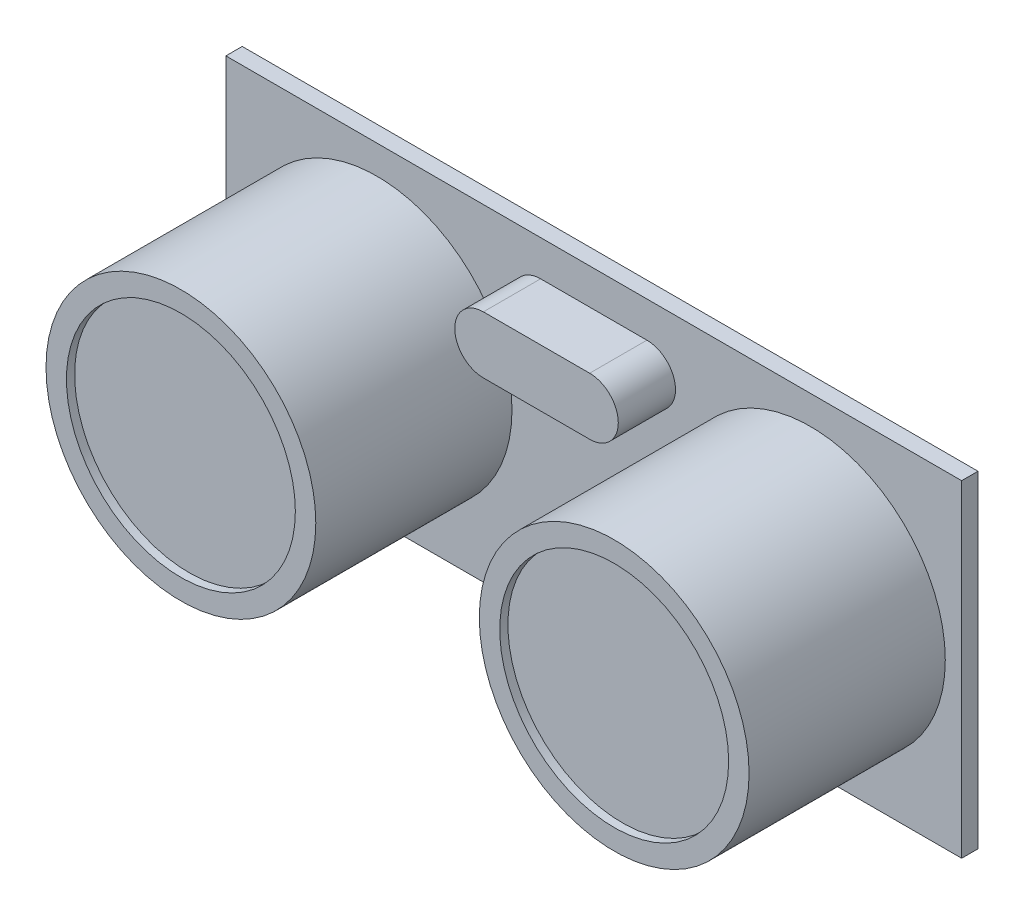
from build123d import *

# Parameters (mm, degrees)
ESBO_O1_W                = 45
ESBO_O1_H                = 20
RESSALTO_EXTRUS_O1_DEPTH = 1
ESBO_O2_R                = 8.25
RESSALTO_EXTRUS_O2_DEPTH = 12
ESBO_O3_R                = 7
CORTE_EXTRUS_O1_DEPTH    = 0.5
RESSALTO_EXTRUS_O5_DEPTH = 3.5
ESBO_O7_W                = 1.9
ESBO_O7_H                = 2
ESBO_O7_W_2              = 1.8
RESSALTO_EXTRUS_O6_DEPTH = 2
ESBO_O9_W                = 10
ESBO_O9_H                = 0.1
CORTE_EXTRUS_O2_DEPTH    = 2
ESBO_O10_W               = 1
ESBO_O10_H               = 1
RESSALTO_EXTRUS_O7_DEPTH = 2
ESBO_O11_W               = 1
ESBO_O11_H               = 1
ESBO_O11_H_2             = 0.967747288
RESSALTO_EXTRUS_O8_DEPTH = 4


with BuildPart() as part:
    # Esboço1 → Ressalto-extrusão1 (new body)
    with BuildSketch(Plane.XY):
        with Locations((22.5, 10)):
            Rectangle(ESBO_O1_W, ESBO_O1_H)
    extrude(amount=RESSALTO_EXTRUS_O1_DEPTH)

    # Esboço2 → Ressalto-extrusão2 (add)
    with BuildSketch(Plane.XY.offset(1)):
        with Locations((9.25, 10)):
            Circle(ESBO_O2_R)
        with Locations((35.75, 10)):
            Circle(ESBO_O2_R)
    extrude(amount=RESSALTO_EXTRUS_O2_DEPTH)

    # Esboço3 → Corte-extrusão1 (cut)
    with BuildSketch(Plane.XY.offset(13)):
        with Locations((9.25, 10)):
            Circle(ESBO_O3_R)
        with Locations((35.75, 10)):
            Circle(ESBO_O3_R)
    extrude(amount=-CORTE_EXTRUS_O1_DEPTH, mode=Mode.SUBTRACT)

    # Esboço6 → Ressalto-extrusão5 (add)
    with BuildSketch(Plane.XY.offset(1)):
        with BuildLine():
            Line((25.75, 17.816758405), (19.25, 17.816758405))
            ThreePointArc((19.25, 17.816758405), (17.5, 16.066758405), (19.25, 14.316758405))
            Line((19.25, 14.316758405), (25.75, 14.316758405))
            ThreePointArc((25.75, 14.316758405), (27.5, 16.066758405), (25.75, 17.816758405))
        make_face()
    extrude(amount=RESSALTO_EXTRUS_O5_DEPTH)

    # Esboço7 → Ressalto-extrusão6 (add)
    with BuildSketch(Plane(origin=(0, 0, 0), x_dir=(-1, 0, 0), z_dir=(0, 0, -1))):
        with Locations((-26.55, 1)):
            Rectangle(ESBO_O7_W, ESBO_O7_H)
        with Locations((-24.5, 1)):
            Rectangle(ESBO_O7_W_2, ESBO_O7_H)
        with Locations((-22.5, 1)):
            Rectangle(ESBO_O7_W_2, ESBO_O7_H)
        with Locations((-18.45, 1)):
            Rectangle(ESBO_O7_W, ESBO_O7_H)
        with Locations((-20.5, 1)):
            Rectangle(ESBO_O7_W_2, ESBO_O7_H)
    extrude(amount=RESSALTO_EXTRUS_O6_DEPTH)

    # Esboço9 → Corte-extrusão2 (cut)
    with BuildSketch(Plane(origin=(0, 0, -2), x_dir=(-1, 0, 0), z_dir=(0, 0, -1))):
        with Locations((-22.5, 0.05)):
            Rectangle(ESBO_O9_W, ESBO_O9_H)
    extrude(amount=-CORTE_EXTRUS_O2_DEPTH, mode=Mode.SUBTRACT)

    # Esboço10 → Ressalto-extrusão7 (add)
    with BuildSketch(Plane(origin=(0, 0, -2), x_dir=(-1, 0, 0), z_dir=(0, 0, -1))):
        with Locations((-24.5, 1.05)):
            Rectangle(ESBO_O10_W, ESBO_O10_H)
        with Locations((-26.55, 1.05)):
            Rectangle(ESBO_O10_W, ESBO_O10_H)
        with Locations((-22.472435469, 1.05)):
            Rectangle(ESBO_O10_W, ESBO_O10_H)
        with Locations((-20.46939422, 1.05)):
            Rectangle(ESBO_O10_W, ESBO_O10_H)
        with Locations((-18.471440092, 1.05)):
            Rectangle(ESBO_O10_W, ESBO_O10_H)
    extrude(amount=RESSALTO_EXTRUS_O7_DEPTH)

    # Esboço11 → Ressalto-extrusão8 (add)
    with BuildSketch(Plane.XZ.offset(-0.55)):
        with Locations((26.55, -3.5)):
            Rectangle(ESBO_O11_W, ESBO_O11_H)
        with Locations((24.5, -3.5)):
            Rectangle(ESBO_O11_W, ESBO_O11_H)
        with Locations((22.472435469, -3.516126356)):
            Rectangle(ESBO_O11_W, ESBO_O11_H_2)
        with Locations((20.46939422, -3.516126356)):
            Rectangle(ESBO_O11_W, ESBO_O11_H_2)
        with Locations((18.471440092, -3.516126356)):
            Rectangle(ESBO_O11_W, ESBO_O11_H_2)
    extrude(amount=RESSALTO_EXTRUS_O8_DEPTH)


solid = part.part
